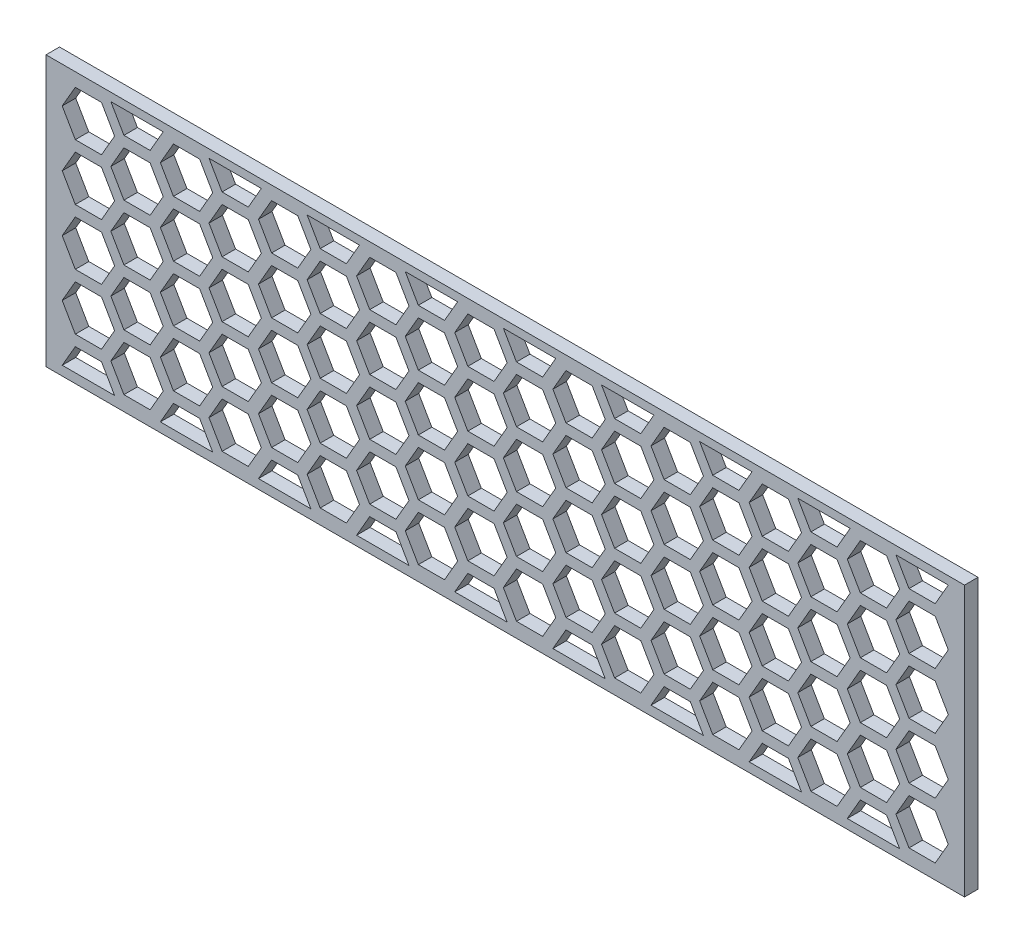
from build123d import *

# Parameters (mm, degrees)
ESBO_O1_W                = 170
ESBO_O1_H                = 50
RESSALTO_EXTRUS_O1_DEPTH = 2.5
CORTE_EXTRUS_O1_DEPTH    = 6


with BuildPart() as part:
    # Esboço1 → Ressalto-extrusão1 (new body)
    with BuildSketch(Plane.XY):
        Rectangle(ESBO_O1_W, ESBO_O1_H)
    extrude(amount=RESSALTO_EXTRUS_O1_DEPTH)

    # Esboço3 → Corte-extrusão1 (cut)
    with BuildSketch(Plane(origin=(0, 0, 0), x_dir=(-1, 0, 0), z_dir=(0, 0, -1))):
        Polygon((-82, 23.5), (-79.576279931, 19.301993697), (-74.728839794, 19.301993697), (-72.305119725, 23.5), align=None)
        Polygon((-63.305119725, 18.303847577), (-65.728839794, 22.50185388), (-70.576279931, 22.50185388), (-73, 18.303847577), (-70.576279931, 14.105841275), (-65.728839794, 14.105841275), align=None)
        Polygon((63.305119725, 23.5), (73, 23.5), (70.576279931, 19.301993697), (65.728839794, 19.301993697), align=None)
        Polygon((-63.836860034, 23.5), (-61.413139966, 19.301993697), (-56.565699828, 19.301993697), (-54.141979759, 23.5), align=None)
        Polygon((-45.141979759, 18.303847577), (-47.565699828, 22.50185388), (-52.413139966, 22.50185388), (-54.836860034, 18.303847577), (-52.413139966, 14.105841275), (-47.565699828, 14.105841275), align=None)
        Polygon((-45.673720069, 23.5), (-43.25, 19.301993697), (-38.402559862, 19.301993697), (-35.978839794, 23.5), align=None)
        Polygon((-26.978839794, 18.303847577), (-29.402559862, 22.50185388), (-34.25, 22.50185388), (-36.673720069, 18.303847577), (-34.25, 14.105841275), (-29.402559862, 14.105841275), align=None)
        Polygon((-27.510580103, 23.5), (-25.086860034, 19.301993697), (-20.239419897, 19.301993697), (-17.815699828, 23.5), align=None)
        Polygon((-8.815699828, 18.303847577), (-11.239419897, 22.50185388), (-16.086860034, 22.50185388), (-18.510580103, 18.303847577), (-16.086860034, 14.105841275), (-11.239419897, 14.105841275), align=None)
        Polygon((-9.347440138, 23.5), (-6.923720069, 19.301993697), (-2.076279931, 19.301993697), (0.347440138, 23.5), align=None)
        Polygon((9.347440138, 18.303847577), (6.923720069, 22.50185388), (2.076279931, 22.50185388), (-0.347440138, 18.303847577), (2.076279931, 14.105841275), (6.923720069, 14.105841275), align=None)
        Polygon((8.815699828, 23.5), (11.239419897, 19.301993697), (16.086860034, 19.301993697), (18.510580103, 23.5), align=None)
        Polygon((27.510580103, 18.303847577), (25.086860034, 22.50185388), (20.239419897, 22.50185388), (17.815699828, 18.303847577), (20.239419897, 14.105841275), (25.086860034, 14.105841275), align=None)
        Polygon((26.978839794, 23.5), (29.402559862, 19.301993697), (34.25, 19.301993697), (36.673720069, 23.5), align=None)
        Polygon((45.673720069, 18.303847577), (43.25, 22.50185388), (38.402559862, 22.50185388), (35.978839794, 18.303847577), (38.402559862, 14.105841275), (43.25, 14.105841275), align=None)
        Polygon((45.141979759, 23.5), (47.565699828, 19.301993697), (52.413139966, 19.301993697), (54.836860034, 23.5), align=None)
        Polygon((63.836860034, 18.303847577), (61.413139966, 22.50185388), (56.565699828, 22.50185388), (54.141979759, 18.303847577), (56.565699828, 14.105841275), (61.413139966, 14.105841275), align=None)
        Polygon((82, 18.303847577), (79.576279931, 22.50185388), (74.728839794, 22.50185388), (72.305119725, 18.303847577), (74.728839794, 14.105841275), (79.576279931, 14.105841275), align=None)
        Polygon((-54.141979759, 13.107695155), (-56.565699828, 17.305701457), (-61.413139966, 17.305701457), (-63.836860034, 13.107695155), (-61.413139966, 8.909688852), (-56.565699828, 8.909688852), align=None)
        Polygon((-45.141979759, 7.911542732), (-47.565699828, 12.109549034), (-52.413139966, 12.109549034), (-54.836860034, 7.911542732), (-52.413139966, 3.713536429), (-47.565699828, 3.713536429), align=None)
        Polygon((-35.978839794, 13.107695155), (-38.402559862, 17.305701457), (-43.25, 17.305701457), (-45.673720069, 13.107695155), (-43.25, 8.909688852), (-38.402559862, 8.909688852), align=None)
        Polygon((-26.978839794, 7.911542732), (-29.402559862, 12.109549034), (-34.25, 12.109549034), (-36.673720069, 7.911542732), (-34.25, 3.713536429), (-29.402559862, 3.713536429), align=None)
        Polygon((-17.815699828, 13.107695155), (-20.239419897, 17.305701457), (-25.086860034, 17.305701457), (-27.510580103, 13.107695155), (-25.086860034, 8.909688852), (-20.239419897, 8.909688852), align=None)
        Polygon((-8.815699828, 7.911542732), (-11.239419897, 12.109549034), (-16.086860034, 12.109549034), (-18.510580103, 7.911542732), (-16.086860034, 3.713536429), (-11.239419897, 3.713536429), align=None)
        Polygon((0.347440138, 13.107695155), (-2.076279931, 17.305701457), (-6.923720069, 17.305701457), (-9.347440138, 13.107695155), (-6.923720069, 8.909688852), (-2.076279931, 8.909688852), align=None)
        Polygon((9.347440138, 7.911542732), (6.923720069, 12.109549034), (2.076279931, 12.109549034), (-0.347440138, 7.911542732), (2.076279931, 3.713536429), (6.923720069, 3.713536429), align=None)
        Polygon((18.510580103, 13.107695155), (16.086860034, 17.305701457), (11.239419897, 17.305701457), (8.815699828, 13.107695155), (11.239419897, 8.909688852), (16.086860034, 8.909688852), align=None)
        Polygon((27.510580103, 7.911542732), (25.086860034, 12.109549034), (20.239419897, 12.109549034), (17.815699828, 7.911542732), (20.239419897, 3.713536429), (25.086860034, 3.713536429), align=None)
        Polygon((36.673720069, 13.107695155), (34.25, 17.305701457), (29.402559862, 17.305701457), (26.978839794, 13.107695155), (29.402559862, 8.909688852), (34.25, 8.909688852), align=None)
        Polygon((45.673720069, 7.911542732), (43.25, 12.109549034), (38.402559862, 12.109549034), (35.978839794, 7.911542732), (38.402559862, 3.713536429), (43.25, 3.713536429), align=None)
        Polygon((54.836860034, 13.107695155), (52.413139966, 17.305701457), (47.565699828, 17.305701457), (45.141979759, 13.107695155), (47.565699828, 8.909688852), (52.413139966, 8.909688852), align=None)
        Polygon((63.836860034, 7.911542732), (61.413139966, 12.109549034), (56.565699828, 12.109549034), (54.141979759, 7.911542732), (56.565699828, 3.713536429), (61.413139966, 3.713536429), align=None)
        Polygon((73, 13.107695155), (70.576279931, 17.305701457), (65.728839794, 17.305701457), (63.305119725, 13.107695155), (65.728839794, 8.909688852), (70.576279931, 8.909688852), align=None)
        Polygon((82, 7.911542732), (79.576279931, 12.109549034), (74.728839794, 12.109549034), (72.305119725, 7.911542732), (74.728839794, 3.713536429), (79.576279931, 3.713536429), align=None)
        Polygon((-54.141979759, 2.715390309), (-56.565699828, 6.913396612), (-61.413139966, 6.913396612), (-63.836860034, 2.715390309), (-61.413139966, -1.482615993), (-56.565699828, -1.482615993), align=None)
        Polygon((-45.141979759, -2.480762114), (-47.565699828, 1.717244189), (-52.413139966, 1.717244189), (-54.836860034, -2.480762114), (-52.413139966, -6.678768416), (-47.565699828, -6.678768416), align=None)
        Polygon((-35.978839794, 2.715390309), (-38.402559862, 6.913396612), (-43.25, 6.913396612), (-45.673720069, 2.715390309), (-43.25, -1.482615993), (-38.402559862, -1.482615993), align=None)
        Polygon((-26.978839794, -2.480762114), (-29.402559862, 1.717244189), (-34.25, 1.717244189), (-36.673720069, -2.480762114), (-34.25, -6.678768416), (-29.402559862, -6.678768416), align=None)
        Polygon((-17.815699828, 2.715390309), (-20.239419897, 6.913396612), (-25.086860034, 6.913396612), (-27.510580103, 2.715390309), (-25.086860034, -1.482615993), (-20.239419897, -1.482615993), align=None)
        Polygon((-8.815699828, -2.480762114), (-11.239419897, 1.717244189), (-16.086860034, 1.717244189), (-18.510580103, -2.480762114), (-16.086860034, -6.678768416), (-11.239419897, -6.678768416), align=None)
        Polygon((0.347440138, 2.715390309), (-2.076279931, 6.913396612), (-6.923720069, 6.913396612), (-9.347440138, 2.715390309), (-6.923720069, -1.482615993), (-2.076279931, -1.482615993), align=None)
        Polygon((9.347440138, -2.480762114), (6.923720069, 1.717244189), (2.076279931, 1.717244189), (-0.347440138, -2.480762114), (2.076279931, -6.678768416), (6.923720069, -6.678768416), align=None)
        Polygon((18.510580103, 2.715390309), (16.086860034, 6.913396612), (11.239419897, 6.913396612), (8.815699828, 2.715390309), (11.239419897, -1.482615993), (16.086860034, -1.482615993), align=None)
        Polygon((27.510580103, -2.480762114), (25.086860034, 1.717244189), (20.239419897, 1.717244189), (17.815699828, -2.480762114), (20.239419897, -6.678768416), (25.086860034, -6.678768416), align=None)
        Polygon((36.673720069, 2.715390309), (34.25, 6.913396612), (29.402559862, 6.913396612), (26.978839794, 2.715390309), (29.402559862, -1.482615993), (34.25, -1.482615993), align=None)
        Polygon((45.673720069, -2.480762114), (43.25, 1.717244189), (38.402559862, 1.717244189), (35.978839794, -2.480762114), (38.402559862, -6.678768416), (43.25, -6.678768416), align=None)
        Polygon((54.836860034, 2.715390309), (52.413139966, 6.913396612), (47.565699828, 6.913396612), (45.141979759, 2.715390309), (47.565699828, -1.482615993), (52.413139966, -1.482615993), align=None)
        Polygon((63.836860034, -2.480762114), (61.413139966, 1.717244189), (56.565699828, 1.717244189), (54.141979759, -2.480762114), (56.565699828, -6.678768416), (61.413139966, -6.678768416), align=None)
        Polygon((73, 2.715390309), (70.576279931, 6.913396612), (65.728839794, 6.913396612), (63.305119725, 2.715390309), (65.728839794, -1.482615993), (70.576279931, -1.482615993), align=None)
        Polygon((82, -2.480762114), (79.576279931, 1.717244189), (74.728839794, 1.717244189), (72.305119725, -2.480762114), (74.728839794, -6.678768416), (79.576279931, -6.678768416), align=None)
        Polygon((-54.141979759, -7.676914536), (-56.565699828, -3.478908234), (-61.413139966, -3.478908234), (-63.836860034, -7.676914536), (-61.413139966, -11.874920839), (-56.565699828, -11.874920839), align=None)
        Polygon((-45.141979759, -12.873066959), (-47.565699828, -8.675060656), (-52.413139966, -8.675060656), (-54.836860034, -12.873066959), (-52.413139966, -17.071073261), (-47.565699828, -17.071073261), align=None)
        Polygon((-35.978839794, -7.676914536), (-38.402559862, -3.478908234), (-43.25, -3.478908234), (-45.673720069, -7.676914536), (-43.25, -11.874920839), (-38.402559862, -11.874920839), align=None)
        Polygon((-26.978839794, -12.873066959), (-29.402559862, -8.675060656), (-34.25, -8.675060656), (-36.673720069, -12.873066959), (-34.25, -17.071073261), (-29.402559862, -17.071073261), align=None)
        Polygon((-17.815699828, -7.676914536), (-20.239419897, -3.478908234), (-25.086860034, -3.478908234), (-27.510580103, -7.676914536), (-25.086860034, -11.874920839), (-20.239419897, -11.874920839), align=None)
        Polygon((-8.815699828, -12.873066959), (-11.239419897, -8.675060656), (-16.086860034, -8.675060656), (-18.510580103, -12.873066959), (-16.086860034, -17.071073261), (-11.239419897, -17.071073261), align=None)
        Polygon((0.347440138, -7.676914536), (-2.076279931, -3.478908234), (-6.923720069, -3.478908234), (-9.347440138, -7.676914536), (-6.923720069, -11.874920839), (-2.076279931, -11.874920839), align=None)
        Polygon((9.347440138, -12.873066959), (6.923720069, -8.675060656), (2.076279931, -8.675060656), (-0.347440138, -12.873066959), (2.076279931, -17.071073261), (6.923720069, -17.071073261), align=None)
        Polygon((18.510580103, -7.676914536), (16.086860034, -3.478908234), (11.239419897, -3.478908234), (8.815699828, -7.676914536), (11.239419897, -11.874920839), (16.086860034, -11.874920839), align=None)
        Polygon((27.510580103, -12.873066959), (25.086860034, -8.675060656), (20.239419897, -8.675060656), (17.815699828, -12.873066959), (20.239419897, -17.071073261), (25.086860034, -17.071073261), align=None)
        Polygon((36.673720069, -7.676914536), (34.25, -3.478908234), (29.402559862, -3.478908234), (26.978839794, -7.676914536), (29.402559862, -11.874920839), (34.25, -11.874920839), align=None)
        Polygon((45.673720069, -12.873066959), (43.25, -8.675060656), (38.402559862, -8.675060656), (35.978839794, -12.873066959), (38.402559862, -17.071073261), (43.25, -17.071073261), align=None)
        Polygon((54.836860034, -7.676914536), (52.413139966, -3.478908234), (47.565699828, -3.478908234), (45.141979759, -7.676914536), (47.565699828, -11.874920839), (52.413139966, -11.874920839), align=None)
        Polygon((63.836860034, -12.873066959), (61.413139966, -8.675060656), (56.565699828, -8.675060656), (54.141979759, -12.873066959), (56.565699828, -17.071073261), (61.413139966, -17.071073261), align=None)
        Polygon((73, -7.676914536), (70.576279931, -3.478908234), (65.728839794, -3.478908234), (63.305119725, -7.676914536), (65.728839794, -11.874920839), (70.576279931, -11.874920839), align=None)
        Polygon((82, -12.873066959), (79.576279931, -8.675060656), (74.728839794, -8.675060656), (72.305119725, -12.873066959), (74.728839794, -17.071073261), (79.576279931, -17.071073261), align=None)
        Polygon((-72.305119725, 13.107695155), (-74.728839794, 17.305701457), (-79.576279931, 17.305701457), (-82, 13.107695155), (-79.576279931, 8.909688852), (-74.728839794, 8.909688852), align=None)
        Polygon((-63.305119725, 7.911542732), (-65.728839794, 12.109549034), (-70.576279931, 12.109549034), (-73, 7.911542732), (-70.576279931, 3.713536429), (-65.728839794, 3.713536429), align=None)
        Polygon((-72.305119725, 2.715390309), (-74.728839794, 6.913396612), (-79.576279931, 6.913396612), (-82, 2.715390309), (-79.576279931, -1.482615993), (-74.728839794, -1.482615993), align=None)
        Polygon((-63.305119725, -2.480762114), (-65.728839794, 1.717244189), (-70.576279931, 1.717244189), (-73, -2.480762114), (-70.576279931, -6.678768416), (-65.728839794, -6.678768416), align=None)
        Polygon((-72.305119725, -7.676914536), (-74.728839794, -3.478908234), (-79.576279931, -3.478908234), (-82, -7.676914536), (-79.576279931, -11.874920839), (-74.728839794, -11.874920839), align=None)
        Polygon((-63.305119725, -12.873066959), (-65.728839794, -8.675060656), (-70.576279931, -8.675060656), (-73, -12.873066959), (-70.576279931, -17.071073261), (-65.728839794, -17.071073261), align=None)
        Polygon((-72.305119725, -18.069219382), (-74.728839794, -13.871213079), (-79.576279931, -13.871213079), (-82, -18.069219382), (-79.576279931, -22.267225684), (-74.728839794, -22.267225684), align=None)
        Polygon((-63.305119725, -23.265371804), (-65.728839794, -19.067365502), (-70.576279931, -19.067365502), (-73, -23.265371804), align=None)
        Polygon((-54.141979759, -18.069219382), (-56.565699828, -13.871213079), (-61.413139966, -13.871213079), (-63.836860034, -18.069219382), (-61.413139966, -22.267225684), (-56.565699828, -22.267225684), align=None)
        Polygon((-45.141979759, -23.265371804), (-47.565699828, -19.067365502), (-52.413139966, -19.067365502), (-54.836860034, -23.265371804), align=None)
        Polygon((-35.978839794, -18.069219382), (-38.402559862, -13.871213079), (-43.25, -13.871213079), (-45.673720069, -18.069219382), (-43.25, -22.267225684), (-38.402559862, -22.267225684), align=None)
        Polygon((-26.978839794, -23.265371804), (-29.402559862, -19.067365502), (-34.25, -19.067365502), (-36.673720069, -23.265371804), align=None)
        Polygon((-17.815699828, -18.069219382), (-20.239419897, -13.871213079), (-25.086860034, -13.871213079), (-27.510580103, -18.069219382), (-25.086860034, -22.267225684), (-20.239419897, -22.267225684), align=None)
        Polygon((-8.815699828, -23.265371804), (-11.239419897, -19.067365502), (-16.086860034, -19.067365502), (-18.510580103, -23.265371804), align=None)
        Polygon((0.347440138, -18.069219382), (-2.076279931, -13.871213079), (-6.923720069, -13.871213079), (-9.347440138, -18.069219382), (-6.923720069, -22.267225684), (-2.076279931, -22.267225684), align=None)
        Polygon((9.347440138, -23.265371804), (6.923720069, -19.067365502), (2.076279931, -19.067365502), (-0.347440138, -23.265371804), align=None)
        Polygon((18.510580103, -18.069219382), (16.086860034, -13.871213079), (11.239419897, -13.871213079), (8.815699828, -18.069219382), (11.239419897, -22.267225684), (16.086860034, -22.267225684), align=None)
        Polygon((27.510580103, -23.265371804), (25.086860034, -19.067365502), (20.239419897, -19.067365502), (17.815699828, -23.265371804), align=None)
        Polygon((36.673720069, -18.069219382), (34.25, -13.871213079), (29.402559862, -13.871213079), (26.978839794, -18.069219382), (29.402559862, -22.267225684), (34.25, -22.267225684), align=None)
        Polygon((45.673720069, -23.265371804), (43.25, -19.067365502), (38.402559862, -19.067365502), (35.978839794, -23.265371804), align=None)
        Polygon((54.836860034, -18.069219382), (52.413139966, -13.871213079), (47.565699828, -13.871213079), (45.141979759, -18.069219382), (47.565699828, -22.267225684), (52.413139966, -22.267225684), align=None)
        Polygon((63.836860034, -23.265371804), (61.413139966, -19.067365502), (56.565699828, -19.067365502), (54.141979759, -23.265371804), align=None)
        Polygon((73, -18.069219382), (70.576279931, -13.871213079), (65.728839794, -13.871213079), (63.305119725, -18.069219382), (65.728839794, -22.267225684), (70.576279931, -22.267225684), align=None)
        Polygon((82, -23.265371804), (79.576279931, -19.067365502), (74.728839794, -19.067365502), (72.305119725, -23.265371804), align=None)
    extrude(amount=-CORTE_EXTRUS_O1_DEPTH, mode=Mode.SUBTRACT)


solid = part.part
